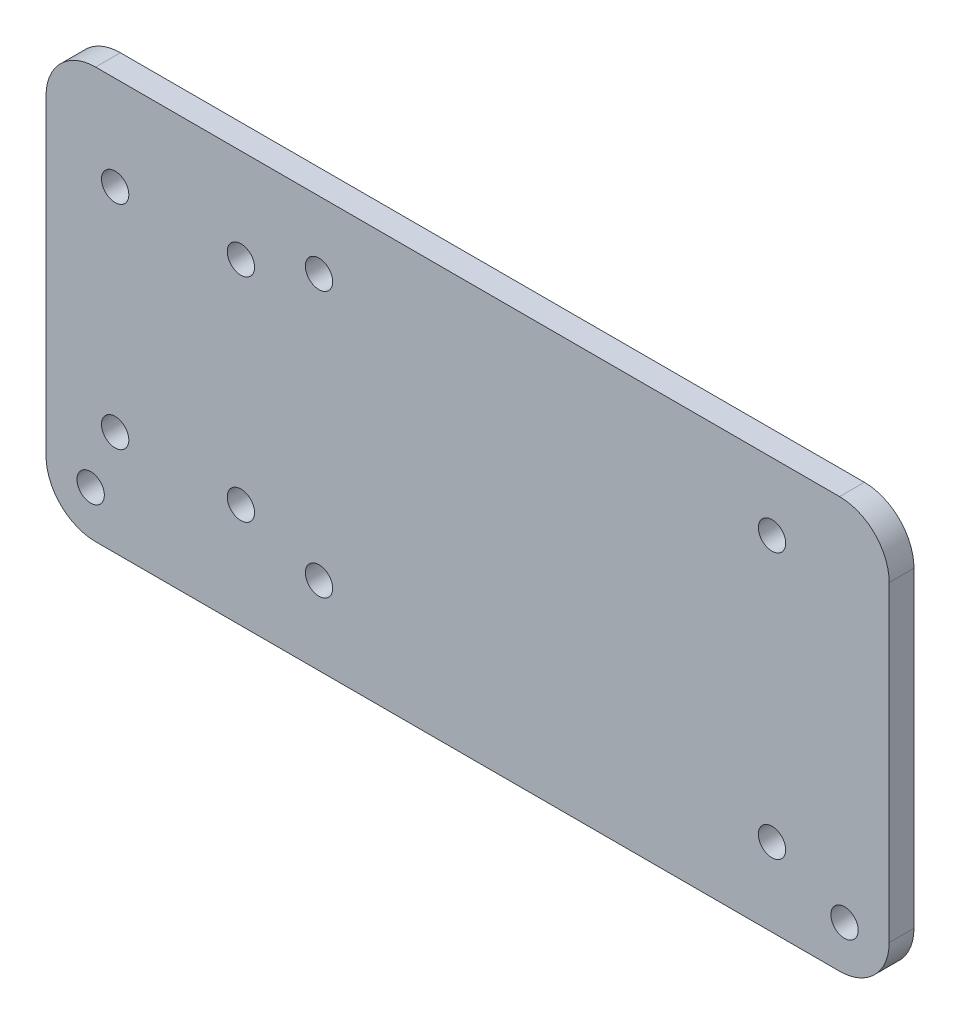
from build123d import *

# Parameters (mm, degrees)
SKETCH1_W           = 107.95
SKETCH1_H           = 87.63
BOSS_EXTRUDE1_DEPTH = 3.175
SKETCH2_R           = 1.75
CUT_EXTRUDE1_DEPTH  = 70.592639517
SKETCH3_R           = 1.75
CUT_EXTRUDE2_DEPTH  = 70.592639517
SKETCH4_W           = 107.95
SKETCH4_H           = 35
CUT_EXTRUDE3_DEPTH  = 70.592639517
FILLET1_R           = 6.35


with BuildPart() as part:
    # Sketch1 → Boss-Extrude1 (new body)
    with BuildSketch(Plane.XY):
        Rectangle(SKETCH1_W, SKETCH1_H)
    extrude(amount=BOSS_EXTRUDE1_DEPTH)

    # Sketch2 → Cut-Extrude1 (cut, through all)
    with BuildSketch(Plane.XY.offset(3.175)):
        with Locations((-48.26, 38.1)):
            Circle(SKETCH2_R)
        with Locations((48.26, 38.1)):
            Circle(SKETCH2_R)
        with Locations((48.26, -38.1)):
            Circle(SKETCH2_R)
        with Locations((-48.26, -38.1)):
            Circle(SKETCH2_R)
    extrude(amount=-CUT_EXTRUDE1_DEPTH, mode=Mode.SUBTRACT)

    # Sketch3 → Cut-Extrude2 (cut, through all)
    with BuildSketch(Plane.XY.offset(3.175)):
        with Locations((-29.025, -3.215)):
            Circle(SKETCH3_R)
        with Locations((-29.025, -30.415)):
            Circle(SKETCH3_R)
        with Locations((-45.125, -30.415)):
            Circle(SKETCH3_R)
        with Locations((-45.125, -3.215)):
            Circle(SKETCH3_R)
        with Locations((-19.025, -33.815)):
            Circle(SKETCH3_R)
        with Locations((38.975, -33.815)):
            Circle(SKETCH3_R)
        with Locations((38.975, 0.185)):
            Circle(SKETCH3_R)
        with Locations((-19.025, 0.185)):
            Circle(SKETCH3_R)
    extrude(amount=-CUT_EXTRUDE2_DEPTH, mode=Mode.SUBTRACT)

    # Sketch4 → Cut-Extrude3 (cut, through all)
    with BuildSketch(Plane.XY.offset(3.175)):
        with Locations((0, 26.315)):
            Rectangle(SKETCH4_W, SKETCH4_H)
    extrude(amount=-CUT_EXTRUDE3_DEPTH, mode=Mode.SUBTRACT)

    # Fillet1
    fillet1_edges = [part.edges().sort_by_distance(p)[0] for p in [
        (-53.975, -43.815, 1.5875),
        (53.975, -43.815, 1.5875),
        (53.975, 8.815, 1.5875),
        (-53.975, 8.815, 1.5875),
    ]]
    fillet(fillet1_edges, radius=FILLET1_R)


solid = part.part
